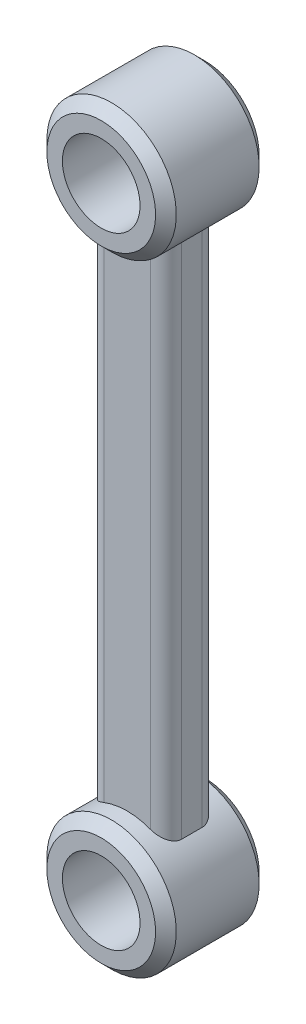
from build123d import *
from build123d.topology import SkipClean

# Parameters (mm, degrees)
BOSS_EXTRUDE1_DEPTH      = 12.7
BOSS_EXTRUDE2_DEPTH      = 6.35
BOSS_EXTRUDE2_DEPTH_BACK = 19.05
SKETCH3_R                = 15.875
FILLET1_R                = 3.81
SKETCH4_R                = 9.525
CUT_EXTRUDE1_DEPTH       = 52.578
CHAMFER1_SIZE            = 2.54


with BuildPart() as part:
    # Sketch2 → Boss-Extrude1 (new body)
    with BuildSketch(Plane.XY):
        with BuildLine():
            Line((-9.525, 12.7), (-9.525, 139.7))
            ThreePointArc((-9.525, 139.7), (0, 168.275), (9.525, 139.7))
            Line((9.525, 139.7), (9.525, 12.7))
            ThreePointArc((9.525, 12.7), (0, -15.875), (-9.525, 12.7))
        make_face()
    extrude(amount=BOSS_EXTRUDE1_DEPTH)

    # Sketch3 → Boss-Extrude2 (add, two sides: drawn at the far end of the back side and taken through both)
    with SkipClean():  # the faces are left unmerged after this step: merging them gives an invalid solid
        with BuildSketch(Plane(origin=(0, 0, 0), x_dir=(-1, 0, 0), z_dir=(0, 0, -1)).offset(-BOSS_EXTRUDE2_DEPTH_BACK)):
            with Locations((0, 152.4)):
                Circle(SKETCH3_R)
            Circle(SKETCH3_R)
        extrude(amount=BOSS_EXTRUDE2_DEPTH + BOSS_EXTRUDE2_DEPTH_BACK)
    add(part.part.scale(1), mode=Mode.REPLACE)  # the faces are merged on a copy

    # Fillet1
    # the kernel refuses this fillet: 3.81 mm, written as the material it takes off along each edge
    with BuildSketch(Plane(origin=(-9.525, 3.175, 12.7), x_dir=(1, 0, 0), z_dir=(0, 1, 0))) as fillet1_piece_1_section:
        with BuildLine():
            CenterArc((FILLET1_R, FILLET1_R), FILLET1_R, 180, 90)
            Line((0, FILLET1_R), (0, 0))
            Line((0, 0), (FILLET1_R, 0))
        make_face()
    fillet1_piece_1 = extrude(amount=146.05, mode=Mode.PRIVATE)
    fillet1_piece_1 = fillet1_piece_1 - Plane(origin=(0, 152.4, 11.833457617), x_dir=(-1, 0, 0), z_dir=(0, 0, -1)) * Cylinder(15.875, 308, mode=Mode.PRIVATE)
    fillet1_piece_1 = fillet1_piece_1 - Plane(origin=(0, 0, 11.833457617), x_dir=(-1, 0, 0), z_dir=(0, 0, -1)) * Cylinder(15.875, 308, mode=Mode.PRIVATE)
    add(fillet1_piece_1, mode=Mode.SUBTRACT)
    with BuildSketch(Plane(origin=(-9.525, 3.175, 0), x_dir=(1, 0, 0), z_dir=(0, 1, 0))) as fillet1_piece_2_section:
        with BuildLine():
            CenterArc((FILLET1_R, -FILLET1_R), FILLET1_R, 90, 90)
            Line((0, -FILLET1_R), (0, 0))
            Line((0, 0), (FILLET1_R, 0))
        make_face()
    fillet1_piece_2 = extrude(amount=146.05, mode=Mode.PRIVATE)
    fillet1_piece_2 = fillet1_piece_2 - Plane(origin=(0, 152.4, 0.866542383), x_dir=(-1, 0, 0), z_dir=(0, 0, 1)) * Cylinder(15.875, 308, mode=Mode.PRIVATE)
    fillet1_piece_2 = fillet1_piece_2 - Plane(origin=(0, 0, 0.866542383), x_dir=(-1, 0, 0), z_dir=(0, 0, 1)) * Cylinder(15.875, 308, mode=Mode.PRIVATE)
    add(fillet1_piece_2, mode=Mode.SUBTRACT)
    with BuildSketch(Plane(origin=(9.525, 149.225, 0), x_dir=(0, 0, 1), z_dir=(0, -1, 0))) as fillet1_piece_3_section:
        with BuildLine():
            CenterArc((FILLET1_R, FILLET1_R), FILLET1_R, 180, 90)
            Line((0, FILLET1_R), (0, 0))
            Line((0, 0), (FILLET1_R, 0))
        make_face()
    fillet1_piece_3 = extrude(amount=146.05, mode=Mode.PRIVATE)
    fillet1_piece_3 = fillet1_piece_3 - Plane(origin=(0, 152.4, 0.866542379), x_dir=(-0.5999999999999995, -0.8000000000000005, 0), z_dir=(0, 0, -1)) * Cylinder(15.875, 308, mode=Mode.PRIVATE)
    fillet1_piece_3 = fillet1_piece_3 - Plane(origin=(0, 0, 0.866542379), x_dir=(0.6000000000000001, 0.7999999999999999, 0), z_dir=(0, 0, -1)) * Cylinder(15.875, 308, mode=Mode.PRIVATE)
    add(fillet1_piece_3, mode=Mode.SUBTRACT)
    with BuildSketch(Plane(origin=(9.525, 149.225, 12.7), x_dir=(0, 0, -1), z_dir=(0, -1, 0))) as fillet1_piece_4_section:
        with BuildLine():
            CenterArc((FILLET1_R, -FILLET1_R), FILLET1_R, 90, 90)
            Line((0, -FILLET1_R), (0, 0))
            Line((0, 0), (FILLET1_R, 0))
        make_face()
    fillet1_piece_4 = extrude(amount=146.05, mode=Mode.PRIVATE)
    fillet1_piece_4 = fillet1_piece_4 - Plane(origin=(0, 152.4, 11.833457621), x_dir=(-0.5999999999999995, -0.8000000000000005, 0), z_dir=(0, 0, -1)) * Cylinder(15.875, 308, mode=Mode.PRIVATE)
    fillet1_piece_4 = fillet1_piece_4 - Plane(origin=(0, 0, 11.833457621), x_dir=(0.6000000000000001, 0.7999999999999999, 0), z_dir=(0, 0, -1)) * Cylinder(15.875, 308, mode=Mode.PRIVATE)
    add(fillet1_piece_4, mode=Mode.SUBTRACT)

    # Sketch4 → Cut-Extrude1 (cut)
    with BuildSketch(Plane(origin=(0, 0, -6.35), x_dir=(-1, 0, 0), z_dir=(0, 0, -1))):
        with Locations((0, 152.4)):
            Circle(SKETCH4_R)
        Circle(SKETCH4_R)
    extrude(amount=-CUT_EXTRUDE1_DEPTH, mode=Mode.SUBTRACT)

    # Chamfer1
    chamfer1_edges = [part.edges().sort_by_distance(p)[0] for p in [
        (15.875, 152.4, 19.05),
        (15.875, 152.4, -6.35),
        (15.875, 0, 19.05),
        (15.875, 0, -6.35),
    ]]
    chamfer(chamfer1_edges, length=CHAMFER1_SIZE)


solid = part.part
